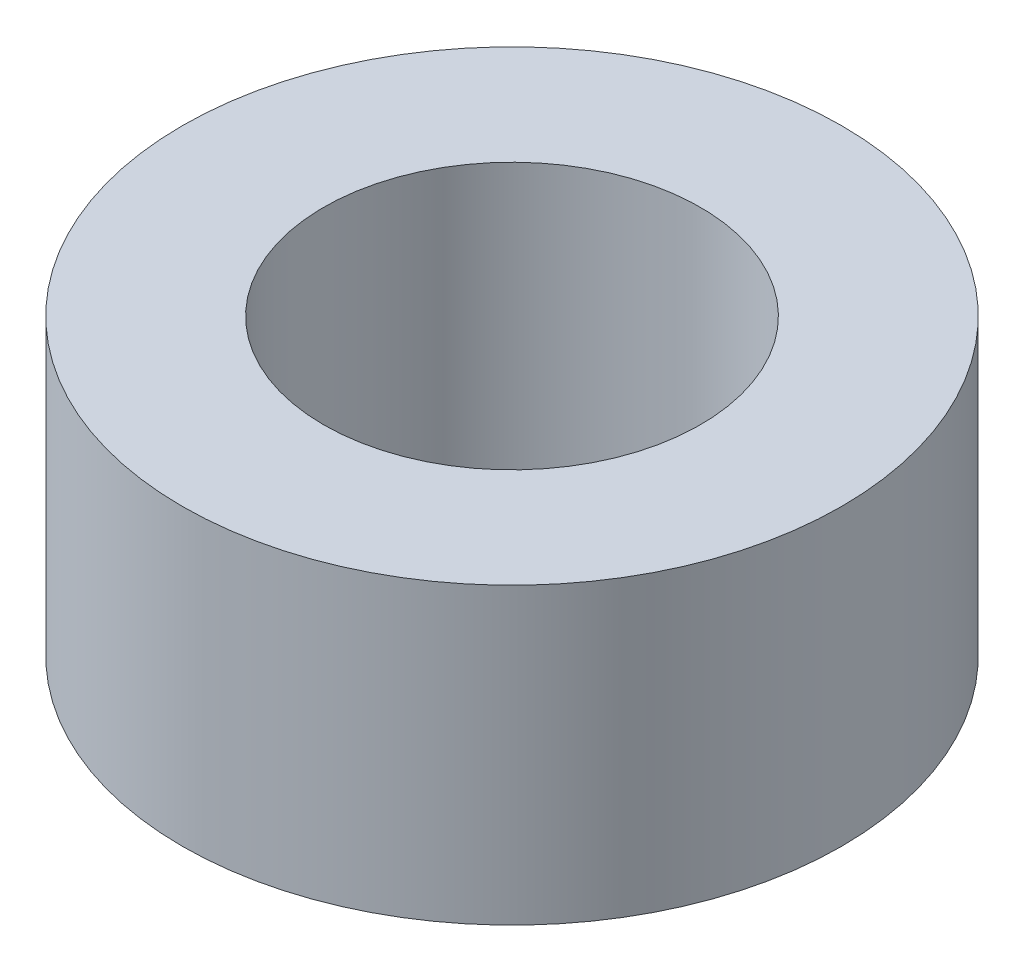
from build123d import *

# Parameters (mm, degrees)
SKETCH1_R           = 28
SKETCH1_R_2         = 16
BOSS_EXTRUDE1_DEPTH = 25


with BuildPart() as part:
    # Sketch1 → Boss-Extrude1 (new body)
    with BuildSketch(Plane(origin=(0, 0, 0), x_dir=(1, 0, 0), z_dir=(0, 1, 0))):
        Circle(SKETCH1_R)
        Circle(SKETCH1_R_2, mode=Mode.SUBTRACT)
    extrude(amount=BOSS_EXTRUDE1_DEPTH)


solid = part.part
